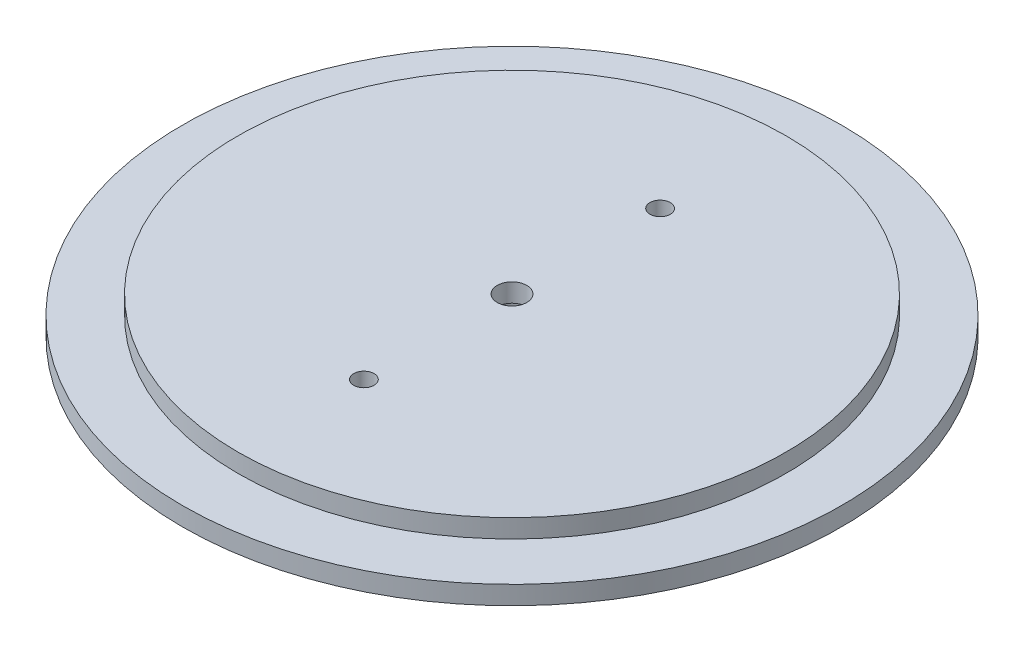
from build123d import *

# Parameters (mm, degrees)
SKETCH1_R           = 89
BOSS_EXTRUDE1_DEPTH = 5
SKETCH2_R           = 74
BOSS_EXTRUDE2_DEPTH = 5
SKETCH3_R           = 2.75
CUT_EXTRUDE1_DEPTH  = 10
SKETCH4_R           = 4
CUT_EXTRUDE2_DEPTH  = 5
SKETCH5_R           = 6
CUT_EXTRUDE3_DEPTH  = 5


with BuildPart() as part:
    # Sketch1 → Boss-Extrude1 (new body)
    with BuildSketch(Plane(origin=(0, 0, 0), x_dir=(1, 0, 0), z_dir=(0, 1, 0))):
        Circle(SKETCH1_R)
    extrude(amount=BOSS_EXTRUDE1_DEPTH)

    # Sketch2 → Boss-Extrude2 (add)
    with BuildSketch(Plane(origin=(0, 5, 0), x_dir=(1, 0, 0), z_dir=(0, 1, 0))):
        Circle(SKETCH2_R)
    extrude(amount=BOSS_EXTRUDE2_DEPTH)

    # Sketch3 → Cut-Extrude1 (cut)
    with BuildSketch(Plane(origin=(0, 10, 0), x_dir=(1, 0, 0), z_dir=(0, 1, 0))):
        with Locations((0, 40)):
            Circle(SKETCH3_R)
        with Locations((0, -40)):
            Circle(SKETCH3_R)
    extrude(amount=-CUT_EXTRUDE1_DEPTH, mode=Mode.SUBTRACT)

    # Sketch4 → Cut-Extrude2 (cut)
    with BuildSketch(Plane(origin=(0, 10, 0), x_dir=(1, 0, 0), z_dir=(0, 1, 0))):
        Circle(SKETCH4_R)
    extrude(amount=-CUT_EXTRUDE2_DEPTH, mode=Mode.SUBTRACT)

    # Sketch5 → Cut-Extrude3 (cut)
    with BuildSketch(Plane.XZ):
        Circle(SKETCH5_R)
    extrude(amount=-CUT_EXTRUDE3_DEPTH, mode=Mode.SUBTRACT)


solid = part.part
